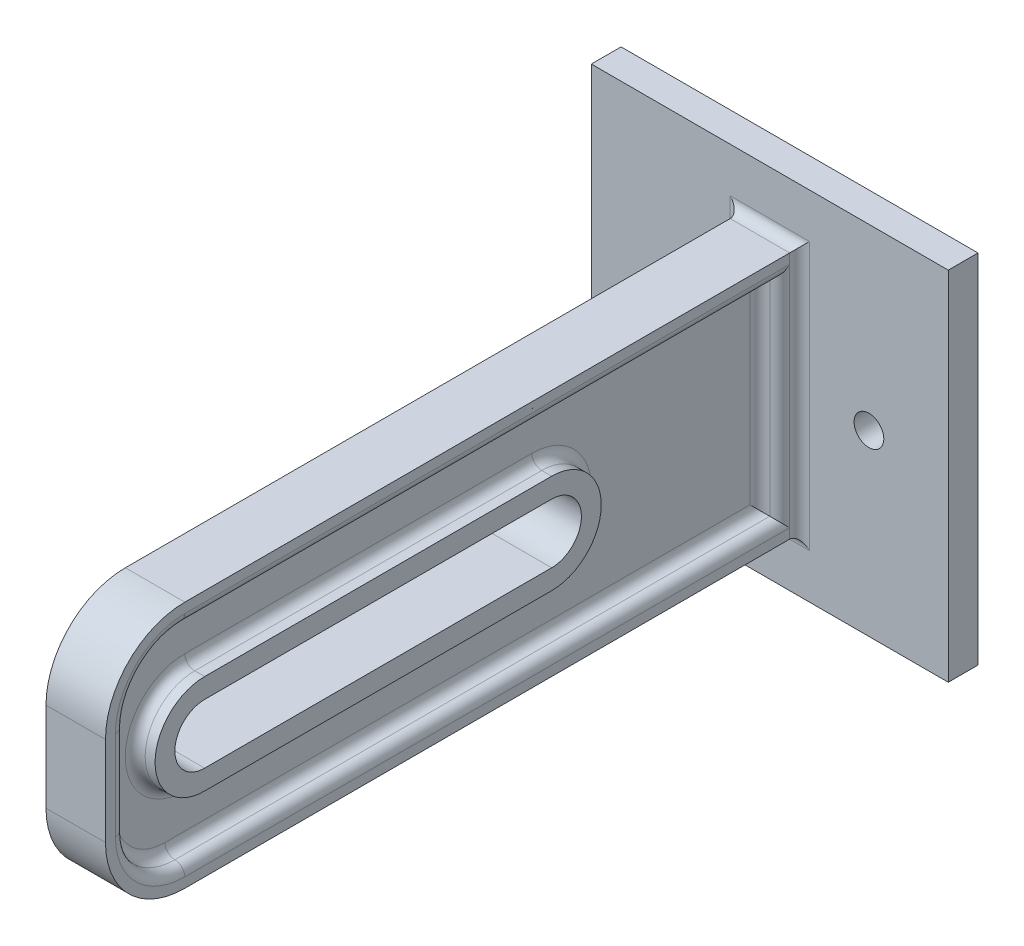
from build123d import *

# Parameters (mm, degrees)
SKETCH1_W           = 36
SKETCH1_H           = 36
BOSS_EXTRUDE1_DEPTH = 1.5
SKETCH2_R           = 1.5
CUT_EXTRUDE1_DEPTH  = 26.632011236
SKETCH3_W           = 6
SKETCH3_H           = 25
BOSS_EXTRUDE2_DEPTH = 70
CUT_EXTRUDE2_DEPTH  = 77.66322456
FILLET1_R           = 8
CUT_EXTRUDE3_DEPTH  = 2
FILLET4_R           = 1


with BuildPart() as part:
    # Sketch1 → Boss-Extrude1 (new, symmetric)
    with BuildSketch(Plane.XY):
        Rectangle(SKETCH1_W, SKETCH1_H)
    extrude(amount=BOSS_EXTRUDE1_DEPTH, both=True)

    # Sketch2 → Cut-Extrude1 (cut, through all)
    with BuildSketch(Plane.XY.offset(1.5)):
        with Locations((-10, 0)):
            Circle(SKETCH2_R)
        with Locations((10, 0)):
            Circle(SKETCH2_R)
    extrude(amount=-CUT_EXTRUDE1_DEPTH, mode=Mode.SUBTRACT)

    # Sketch3 → Boss-Extrude2 (add)
    with BuildSketch(Plane.XY.offset(1.5)):
        Rectangle(SKETCH3_W, SKETCH3_H)
    extrude(amount=BOSS_EXTRUDE2_DEPTH)

    # Sketch4 → Cut-Extrude2 (cut, through all)
    with BuildSketch(Plane(origin=(3, 0, 0), x_dir=(0, 0, -1), z_dir=(1, 0, 0))):
        with BuildLine():
            Line((-61.5, 3), (-26.5, 3))
            ThreePointArc((-26.5, 3), (-23.5, 0), (-26.5, -3))
            Line((-26.5, -3), (-61.5, -3))
            ThreePointArc((-61.5, -3), (-64.5, 0), (-61.5, 3))
        make_face()
    extrude(amount=-CUT_EXTRUDE2_DEPTH, mode=Mode.SUBTRACT)

    # Fillet1
    fillet1_edges = [part.edges().sort_by_distance(p)[0] for p in [
        (0, 12.5, 71.5),
        (0, -12.5, 71.5),
    ]]
    fillet(fillet1_edges, radius=FILLET1_R)

    # Sketch5 → Cut-Extrude3 (cut)
    with BuildSketch(Plane(origin=(3, 0, 0), x_dir=(0, 0, -1), z_dir=(1, 0, 0))):
        with BuildLine():
            Line((-3.5, -10.5), (-3.5, 10.5))
            Line((-3.5, 10.5), (-63.5, 10.5))
            ThreePointArc((-63.5, 10.5), (-67.742640687, 8.742640687), (-69.5, 4.5))
            Line((-69.5, 4.5), (-69.5, -4.5))
            ThreePointArc((-69.5, -4.5), (-67.742640687, -8.742640687), (-63.5, -10.5))
            Line((-63.5, -10.5), (-3.5, -10.5))
        make_face()
        with BuildLine():
            Line((-26.5, 5), (-61.5, 5))
            ThreePointArc((-61.5, 5), (-66.5, 0), (-61.5, -5))
            Line((-61.5, -5), (-26.5, -5))
            ThreePointArc((-26.5, -5), (-21.5, 0), (-26.5, 5))
        make_face(mode=Mode.SUBTRACT)
    cut_extrude3 = extrude(amount=-CUT_EXTRUDE3_DEPTH, mode=Mode.SUBTRACT)

    # Mirror1: Cut-Extrude3 across plane
    add(cut_extrude3.mirror(Plane(origin=(0, 0, 0), x_dir=(0, 0, 1), z_dir=(1, 0, 0))), mode=Mode.SUBTRACT)

    # Fillet4
    fillet4_edges = [part.edges().sort_by_distance(p)[0] for p in [
        (-3, -10.5, 33.5),
        (-3, -8.742640687, 67.742640687),
        (-3, 0, 69.5),
        (-3, 8.742640687, 67.742640687),
        (3, 10.5, 33.5),
        (3, 8.742640687, 67.742640687),
        (3, 0, 69.5),
        (3, -8.742640687, 67.742640687),
        (-1, 10.5, 33.5),
        (-1, 8.742640687, 67.742640687),
        (-1, 0, 69.5),
        (-1, -8.742640687, 67.742640687),
        (-1, -5, 44),
        (-1, 0, 66.5),
        (-1, 5, 44),
        (1, 10.5, 33.5),
        (1, 8.742640687, 67.742640687),
        (1, 0, 69.5),
        (1, -8.742640687, 67.742640687),
        (1, 0, 21.5),
        (1, -5, 44),
        (1, 0, 66.5),
        (0, 12.5, 1.5),
        (0, -12.5, 1.5),
        (-3, 0, 1.5),
        (3, 0, 1.5),
        (-3, 10.5, 33.5),
        (-3, 0, 3.5),
        (3, 0, 3.5),
        (3, -10.5, 33.5),
        (-1, 0, 3.5),
        (-1, -10.5, 33.5),
        (-1, 0, 21.5),
        (1, 0, 3.5),
        (1, -10.5, 33.5),
        (1, 5, 44),
    ]]
    fillet(fillet4_edges, radius=FILLET4_R - 0.0001)  # a hair under: the kernel refuses the full size


solid = part.part
